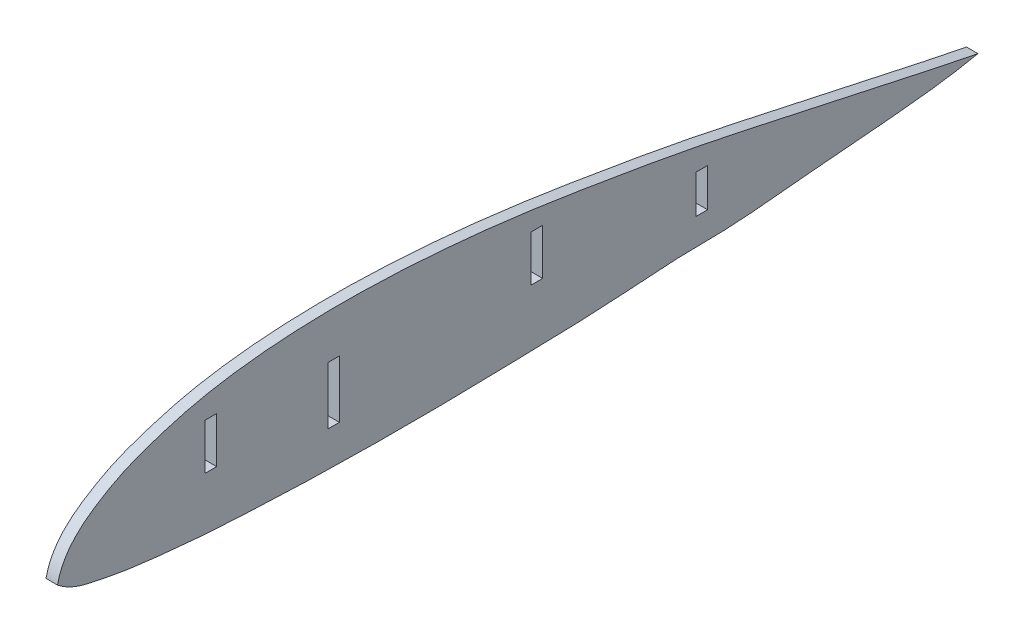
from build123d import *

# Parameters (mm, degrees)
EXTRUDE_1_DEPTH     = 3
SKETCH_2_W          = 3
SKETCH_2_H          = 15
SKETCH_2_H_2        = 10
SKETCH_2_H_3        = 12
CUT_EXTRUDE_1_DEPTH = 3


with BuildPart() as part:
    # Эскиз1 → Бобышка-Вытянуть1 (new body)
    with BuildSketch(Plane(origin=(0, 0, 0), x_dir=(0, 0, -1), z_dir=(1, 0, 0))):
        with BuildLine():
            add(Edge.make_bspline(
                [(-240, 0), (-238.539586148, 6.885975956), (-231.6119689, 12.33782744), (-222.175332595, 17.412091216), (-214.111867769, 20.343482826), (-204.156129061, 23.263904239), (-188.104616678, 25.89332168), (-168.007150597, 26.960143982), (-143.945589986, 26.026388226), (-119.918298994, 23.567750867), (-95.953760008, 19.758812003), (-71.912657951, 15.561977026), (-48.005978392, 10.220578603), (-23.989791717, 5.171383231), (-8.037469261, 1.523600682), (0, 0)],
                knots=[0, 0, 0, 0, 0.075346011, 0.102327605, 0.127890212, 0.177564304, 0.226024831, 0.321726685, 0.417300323, 0.513304723, 0.609920295, 0.706973803, 0.804635001, 0.902346226, 1, 1, 1, 1], degree=3))
            add(Edge.make_bspline(
                [(-240, 0), (-236.52391179, -2.886637123), (-230.220810861, -4.067786061), (-222.028601874, -5.648779907), (-214.009642515, -6.608514015), (-204.019456847, -7.65058139), (-188.010543644, -8.621004369), (-168.008371033, -9.355028053), (-143.997445941, -9.544655848), (-119.996434598, -9.000571646), (-95.984120714, -8.452313319), (-79.444451482, -6.861549256), (-63.412851028, -6.941357818), (-47.421480018, -5.149296578), (-23.951991061, -3.34616289), (-7.916011456, -1.672238148), (0, 0)],
                knots=[0, 0, 0, 0, 0.053475274, 0.07870931, 0.103753204, 0.153672751, 0.203448049, 0.302856431, 0.40219897, 0.501554025, 0.600954522, 0.700430481, 0.707480416, 0.799996455, 0.899715685, 1, 1, 1, 1], degree=3))
        make_face()
    extrude(amount=EXTRUDE_1_DEPTH)

    # Эскиз2 → Вырез-Вытянуть1 (cut)
    with BuildSketch(Plane.ZY):
        with Locations((168, 7.5)):
            Rectangle(SKETCH_2_W, SKETCH_2_H)
        with Locations((72, 5)):
            Rectangle(SKETCH_2_W, SKETCH_2_H_2)
        with Locations((200, 12)):
            Rectangle(SKETCH_2_W, SKETCH_2_H_3)
        with Locations((115, 12)):
            Rectangle(SKETCH_2_W, SKETCH_2_H_3)
    extrude(amount=-CUT_EXTRUDE_1_DEPTH, mode=Mode.SUBTRACT)


solid = part.part
